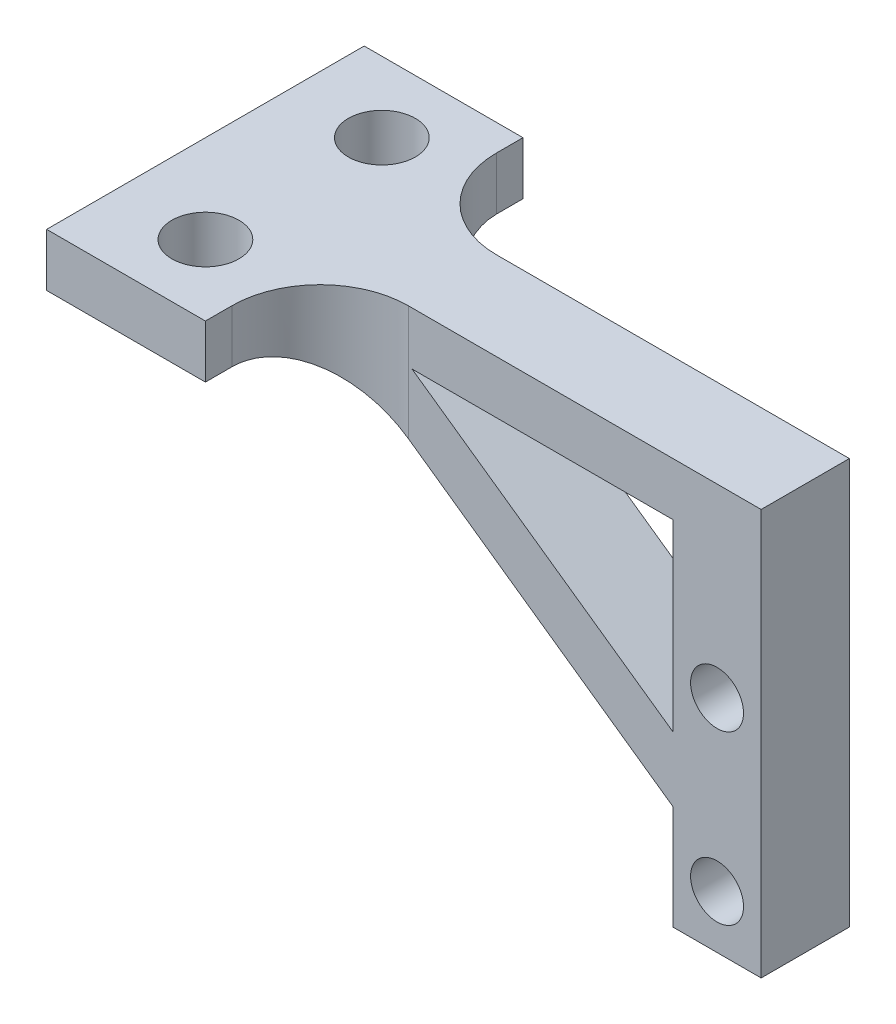
from build123d import *

# Parameters (mm, degrees)
SKETCH1_W                       = 9
SKETCH1_H                       = 18
SKETCH1_R                       = 1.9
BODY_MOUNT_DEPTH                = 3
SKETCH2_W                       = 5
SKETCH2_H                       = 3
BOSS_EXTRUDE2_DEPTH             = 25
SKETCH3_W                       = 5
SKETCH3_H                       = 5
BOSS_EXTRUDE3_DEPTH             = 20
SKETCH4_R                       = 1.5
CUT_EXTRUDE1_DEPTH              = 20
BOSS_EXTRUDE4_REACH             = 38.359
BOSS_EXTRUDE4_DIRECTION_2_REACH = 38.359
FILLET2_R                       = 5


with BuildPart() as part:
    # Sketch1 → body mount (new body)
    with BuildSketch(Plane(origin=(0, 0, 0), x_dir=(1, 0, 0), z_dir=(0, 1, 0))):
        with Locations((-0.5, 5)):
            Rectangle(SKETCH1_W, SKETCH1_H)
        with Locations(Location((0, 0, 0), (0, 0, 270))):
            Circle(SKETCH1_R, mode=Mode.SUBTRACT)
        with Locations(Location((0, 10, 0), (0, 0, 270))):
            Circle(SKETCH1_R, mode=Mode.SUBTRACT)
    extrude(amount=BODY_MOUNT_DEPTH)

    # Sketch2 → Boss-Extrude2 (add)
    with BuildSketch(Plane(origin=(4, 0, 0), x_dir=(0, 0, -1), z_dir=(1, 0, 0))):
        with Locations((5, 1.5)):
            Rectangle(SKETCH2_W, SKETCH2_H)
    extrude(amount=BOSS_EXTRUDE2_DEPTH)

    # Sketch3 → Boss-Extrude3 (add)
    with BuildSketch(Plane.XZ):
        with Locations((26.5, -5)):
            Rectangle(SKETCH3_W, SKETCH3_H)
    extrude(amount=BOSS_EXTRUDE3_DEPTH)

    # Sketch4 → Cut-Extrude1 (cut)
    with BuildSketch(Plane(origin=(0, 0, -7.5), x_dir=(-1, 0, 0), z_dir=(0, 0, -1))):
        with Locations((-26.5, -17)):
            Circle(SKETCH4_R)
        with Locations((-26.5, -7.5)):
            Circle(SKETCH4_R)
    extrude(amount=-CUT_EXTRUDE1_DEPTH, mode=Mode.SUBTRACT)

    # Boss-Extrude4: up to this face of the body (flat: up to its plane)
    boss_extrude4_end = Plane(part.part.faces().sort_by_distance((16.5, 2.660294245, -7.5))[0])
    # Sketch5 → Boss-Extrude4 (add, up to the picked face)
    with BuildSketch(Plane(origin=(0, 0, -5), x_dir=(-1, 0, 0), z_dir=(0, 0, -1)), mode=Mode.PRIVATE) as boss_extrude4_sk1:
        Polygon((-24, -10.415369352), (-9.210305315, 0), (-4, 0), (-24, -14.084630648), align=None)
    boss_extrude4_tool1 = split(extrude(boss_extrude4_sk1.sketch, amount=BOSS_EXTRUDE4_REACH, mode=Mode.PRIVATE), bisect_by=boss_extrude4_end, keep=Keep.BOTH, mode=Mode.PRIVATE)
    add(boss_extrude4_tool1.solids().sort_by(Axis((15.237549, -6.170794, -5), (0, 0, -1)))[0])

    # Boss-Extrude4 direction 2: up to this face of the body (flat: up to its plane)
    boss_extrude4_direction_2_end = Plane(part.part.faces().sort_by_distance((14, 0.339705755, -2.5))[0])
    # Sketch5 → Boss-Extrude4 direction 2 (add, up to the picked face)
    with BuildSketch(Plane(origin=(0, 0, -5), x_dir=(-1, 0, 0), z_dir=(0, 0, -1)), mode=Mode.PRIVATE) as boss_extrude4_direction_2_sk1:
        Polygon((-24, -10.415369352), (-9.210305315, 0), (-4, 0), (-24, -14.084630648), align=None)
    boss_extrude4_direction_2_tool1 = split(extrude(boss_extrude4_direction_2_sk1.sketch, amount=-BOSS_EXTRUDE4_DIRECTION_2_REACH, mode=Mode.PRIVATE), bisect_by=boss_extrude4_direction_2_end, keep=Keep.BOTH, mode=Mode.PRIVATE)
    add(boss_extrude4_direction_2_tool1.solids().sort_by(Axis((15.237549, -6.170794, -5), (0, 0, 1)))[0])

    # Fillet2
    # the kernel refuses this fillet: 5 mm, written as the material it adds along each edge
    with BuildSketch(Plane(origin=(4, 3, -7.5), x_dir=(0, 0, -1), z_dir=(0, -1, 0))) as fillet2_piece_1_section:
        with BuildLine():
            CenterArc((FILLET2_R, FILLET2_R), FILLET2_R, 180, 90)
            Line((0, FILLET2_R), (0, 0))
            Line((0, 0), (FILLET2_R, 0))
        make_face()
    fillet2_piece_1 = extrude(amount=3, mode=Mode.PRIVATE)
    fillet2_piece_1 = split(fillet2_piece_1, bisect_by=Plane(origin=(4.050655402, -0.035673131, -8.630736825), z_dir=(0.5757819971310116, 0.8176032606220598, 0)), keep=Keep.TOP, mode=Mode.PRIVATE)
    add(fillet2_piece_1)
    with BuildSketch(Plane(origin=(4, 3, -7.5), x_dir=(0, 0, -1), z_dir=(0, -1, 0))) as fillet2_piece_2_section:
        with BuildLine():
            CenterArc((FILLET2_R, FILLET2_R), FILLET2_R, 180, 90)
            Line((0, FILLET2_R), (0, 0))
            Line((0, 0), (FILLET2_R, 0))
        make_face()
    fillet2_piece_2 = extrude(amount=15.5, mode=Mode.PRIVATE)
    fillet2_piece_2 = split(fillet2_piece_2, bisect_by=Plane(origin=(6.150590259, 0, -8.032362576), z_dir=(0, -1, 0)), keep=Keep.TOP, mode=Mode.PRIVATE)
    fillet2_piece_2 = split(fillet2_piece_2, bisect_by=Plane(origin=(5.79410314, -1.263464003, -8.032362576), z_dir=(0.5757819971310116, 0.8176032606220598, 0)), keep=Keep.TOP, mode=Mode.PRIVATE)
    add(fillet2_piece_2)
    with BuildSketch(Plane(origin=(4, -12.5, -2.5), x_dir=(1, 0, 0), z_dir=(0, 1, 0))) as fillet2_piece_3_section:
        with BuildLine():
            CenterArc((FILLET2_R, -FILLET2_R), FILLET2_R, 90, 90)
            Line((0, -FILLET2_R), (0, 0))
            Line((0, 0), (FILLET2_R, 0))
        make_face()
    fillet2_piece_3 = extrude(amount=15.5, mode=Mode.PRIVATE)
    fillet2_piece_3 = split(fillet2_piece_3, bisect_by=Plane(origin=(5.79410314, -1.263464003, -1.967637424), z_dir=(0.5757819971310116, 0.8176032606220598, 0)), keep=Keep.TOP, mode=Mode.PRIVATE)
    fillet2_piece_3 = split(fillet2_piece_3, bisect_by=Plane(origin=(6.150590259, 0, -1.967637424), z_dir=(0, -1, 0)), keep=Keep.TOP, mode=Mode.PRIVATE)
    add(fillet2_piece_3)
    with BuildSketch(Plane(origin=(4, 0, -2.5), x_dir=(1, 0, 0), z_dir=(0, 1, 0))) as fillet2_piece_4_section:
        with BuildLine():
            CenterArc((FILLET2_R, -FILLET2_R), FILLET2_R, 90, 90)
            Line((0, -FILLET2_R), (0, 0))
            Line((0, 0), (FILLET2_R, 0))
        make_face()
    fillet2_piece_4 = extrude(amount=3, mode=Mode.PRIVATE)
    fillet2_piece_4 = split(fillet2_piece_4, bisect_by=Plane(origin=(4.050655402, -0.035673131, -1.369263175), z_dir=(0.5757819971310116, 0.8176032606220598, 0)), keep=Keep.TOP, mode=Mode.PRIVATE)
    add(fillet2_piece_4)


solid = part.part
